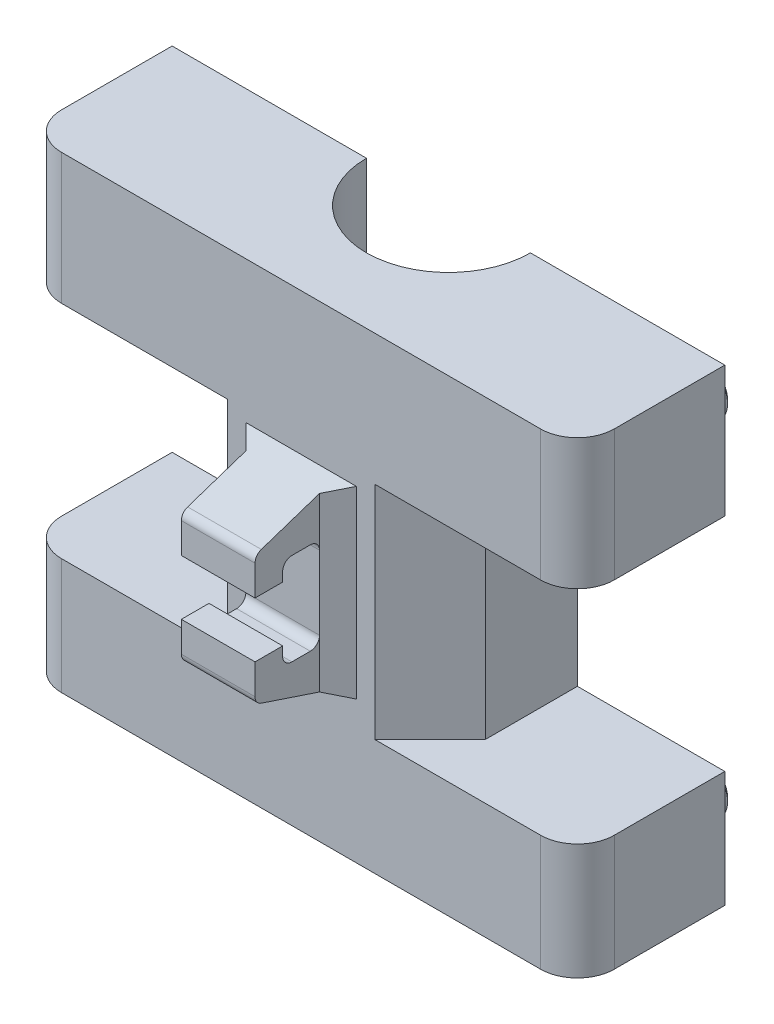
from build123d import *

# Parameters (mm, degrees)
SKETCH1_W               = 30
SKETCH1_H               = 25.4
BOSS_EXTRUDE1_DEPTH     = 8
CUT_EXTRUDE1_DEPTH      = 22.2200377
CUT_EXTRUDE1_DEPTH_BACK = 22.2200377
SKETCH2_R               = 4.45
SKETCH3_R               = 1.35
BOSS_EXTRUDE2_DEPTH     = 2
FILLET1_R               = 0.3
CHAMFER1_SIZE           = 0.2
SKETCH4_W               = 8
SKETCH4_H               = 12
CUT_EXTRUDE2_DEPTH      = 22.2200377
BOSS_EXTRUDE3_DEPTH     = 2
CHAMFER2_SIZE           = 1
FILLET2_R               = 0.5
CHAMFER3_SIZE           = 3
FILLET3_R               = 2


with BuildPart() as part:
    # Sketch1 → Boss-Extrude1 (new body)
    with BuildSketch(Plane.XY):
        Rectangle(SKETCH1_W, SKETCH1_H)
    extrude(amount=BOSS_EXTRUDE1_DEPTH)

    # Sketch2 → Cut-Extrude1 (cut, two sides: drawn at the far end of the back side and taken through both)
    with BuildSketch(Plane(origin=(0, 0, 0), x_dir=(1, 0, 0), z_dir=(0, 1, 0)).offset(-CUT_EXTRUDE1_DEPTH_BACK)):
        Circle(SKETCH2_R)
    extrude(amount=CUT_EXTRUDE1_DEPTH + CUT_EXTRUDE1_DEPTH_BACK, mode=Mode.SUBTRACT)

    # Sketch3 → Boss-Extrude2 (add)
    with BuildSketch(Plane.XY):
        with Locations((-12, 9.15)):
            Circle(SKETCH3_R)
        with Locations((12, 9.15)):
            Circle(SKETCH3_R)
        with Locations((12, -9.55)):
            Circle(SKETCH3_R)
        with Locations((-12, -9.55)):
            Circle(SKETCH3_R)
    extrude(amount=-BOSS_EXTRUDE2_DEPTH)

    # Fillet1
    fillet1_edges = [part.edges().sort_by_distance(p)[0] for p in [
        (-13.35, 9.15, 0),
        (10.65, 9.15, 0),
        (10.65, -9.55, 0),
        (-13.35, -9.55, 0),
    ]]
    fillet(fillet1_edges, radius=FILLET1_R)

    # Chamfer1
    chamfer1_edges = [part.edges().sort_by_distance(p)[0] for p in [
        (-13.35, 9.15, -2),
        (10.65, 9.15, -2),
        (10.65, -9.55, -2),
        (-13.35, -9.55, -2),
    ]]
    chamfer(chamfer1_edges, length=CHAMFER1_SIZE)

    # Sketch4 → Cut-Extrude2 (cut, through all)
    with BuildSketch(Plane.XY):
        with Locations((-11, -0.4)):
            Rectangle(SKETCH4_W, SKETCH4_H)
        with Locations((11, -0.4)):
            Rectangle(SKETCH4_W, SKETCH4_H)
    extrude(amount=CUT_EXTRUDE2_DEPTH, mode=Mode.SUBTRACT)

    # Sketch5 → Boss-Extrude3 (add, symmetric)
    with BuildSketch(Plane(origin=(0, 0, 0), x_dir=(0, 0, -1), z_dir=(1, 0, 0))):
        Polygon((-8, 5), (-8, -5), (-12.5, -3.5), (-12.5, -1.5), (-11, -1.5), (-11, -2.5), (-9, -2.5), (-9, 2.5), (-11, 2.5), (-11, 1.5), (-12.5, 1.5), (-12.5, 3.5), align=None)
    extrude(amount=BOSS_EXTRUDE3_DEPTH, both=True)

    # Chamfer2
    chamfer2_edges = [part.edges().sort_by_distance(p)[0] for p in [
        (2, 0, 8),
        (-2, 0, 8),
    ]]
    chamfer(chamfer2_edges, length=CHAMFER2_SIZE - 0.0001)  # a hair under: the kernel refuses the full size

    # Fillet2
    fillet2_edges = [part.edges().sort_by_distance(p)[0] for p in [
        (0, 3.5, 12.5),
        (0, 2.5, 11),
        (0, 2.5, 9),
        (0, -2.5, 9),
        (0, -2.5, 11),
        (0, -3.5, 12.5),
    ]]
    fillet(fillet2_edges, radius=FILLET2_R)

    # Chamfer3
    chamfer3_edges = [part.edges().sort_by_distance(p)[0] for p in [
        (-7, -0.4, 8),
        (7, -0.4, 8),
    ]]
    chamfer(chamfer3_edges, length=CHAMFER3_SIZE)

    # Fillet3
    fillet3_edges = [part.edges().sort_by_distance(p)[0] for p in [
        (-15, 9.15, 8),
        (15, -9.55, 8),
        (15, 9.15, 8),
        (-15, -9.55, 8),
    ]]
    fillet(fillet3_edges, radius=FILLET3_R)


solid = part.part
